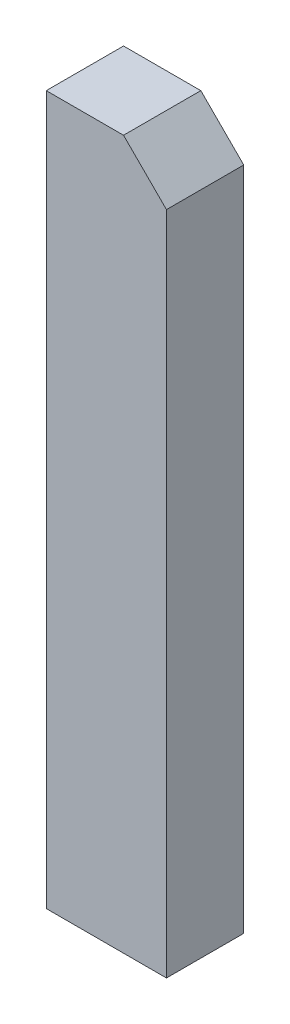
from build123d import *

# Parameters (mm, degrees)
SKETCH2_W           = 2.8
SKETCH2_H           = 1.8
BOSS_EXTRUDE1_DEPTH = 16.5
CHAMFER1_SIZE       = 1


with BuildPart() as part:
    # Sketch2 → Boss-Extrude1 (new body)
    with BuildSketch(Plane(origin=(0, 0, 0), x_dir=(1, 0, 0), z_dir=(0, 1, 0))):
        Rectangle(SKETCH2_W, SKETCH2_H)
    extrude(amount=BOSS_EXTRUDE1_DEPTH)

    # Chamfer1
    chamfer1_edges = [part.edges().sort_by_distance(p)[0] for p in [
        (1.4, 16.5, 0),
    ]]
    chamfer(chamfer1_edges, length=CHAMFER1_SIZE)


solid = part.part
